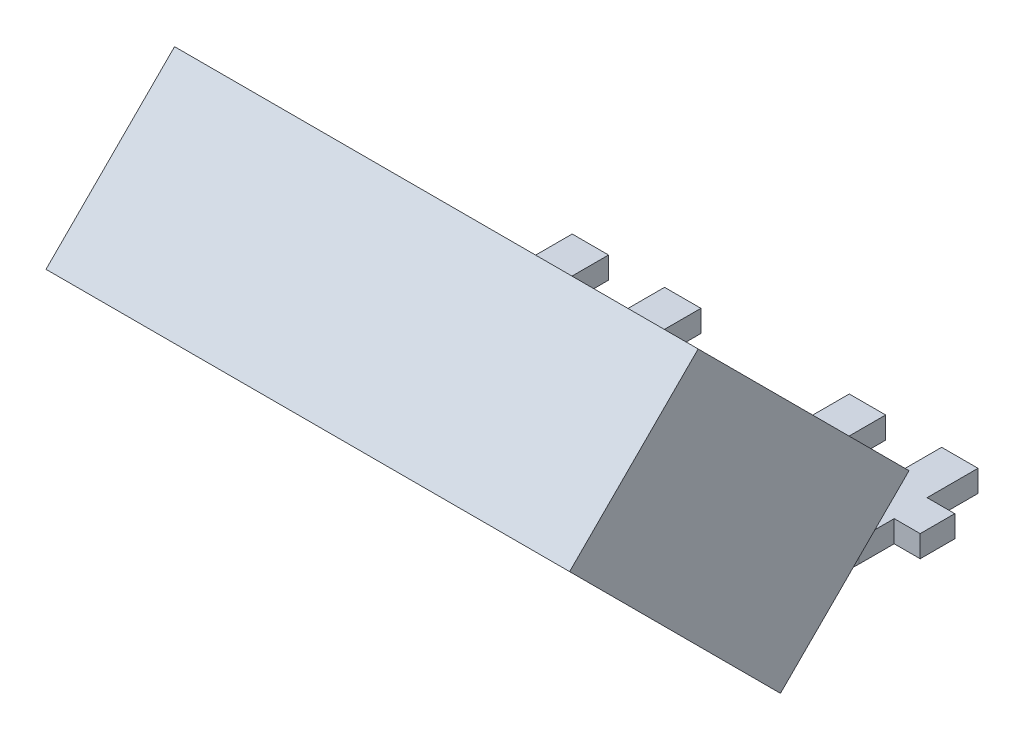
from build123d import *

# Parameters (mm, degrees)
ESQUISSE2_W          = 7.2
ESQUISSE2_H          = 2.5
BOITIER_DEPTH        = 4.1
FENETRECAPTEUR_START = -1.45
ESQUISSE4_R          = 0.8
FENETRECAPTEUR_DEPTH = 0.1
PATTES_DEPTH         = 0.15
PLIAGE_START         = -5
PLIAGE_1_OUTLINE_W   = 7.2
PLIAGE_1_OUTLINE_H   = 4.1
PLIAGE_1_DEPTH       = 4.301040764
PLIAGE_START_2       = -0.698959236
PLIAGE_1_2_OUTLINE_R = 0.8
PLIAGE_1_2_DEPTH     = 0.1
PLIAGE_START_3       = -0.598959236
PLIAGE_1_3_OUTLINE_W = 7.2
PLIAGE_1_3_OUTLINE_H = 4.1
PLIAGE_1_3_DEPTH     = 2.4
PLIAGE_1_4_OUTLINE_W = 7.2
PLIAGE_1_4_OUTLINE_H = 4.1
PLIAGE_1_4_OUTLINE_R = 0.8
PLIAGE_1_4_DEPTH     = 0.1
PLIAGE_START_4       = -3.6
PLIAGE_1_5_DEPTH     = 7.2
PLIAGE_START_5       = -2.813242849
PLIAGE_1_6_DEPTH     = 0.546485698
PLIAGE_START_6       = -1.543242849
PLIAGE_1_7_DEPTH     = 0.546485698
PLIAGE_START_7       = 0.996757151
PLIAGE_1_8_DEPTH     = 0.546485698
PLIAGE_START_8       = 2.266757151
PLIAGE_1_9_DEPTH     = 0.546485698
PLIAGE_START_9       = 0.601040763
PLIAGE_1_10_DEPTH    = 0.300000001


with BuildPart() as part:
    # Esquisse2 → Boitier (new body)
    with BuildSketch(Plane.XY):
        with Locations((0, -0.2)):
            Rectangle(ESQUISSE2_W, ESQUISSE2_H)
    extrude(amount=BOITIER_DEPTH)

    # Esquisse4 → FenetreCapteur (cut)
    with BuildSketch(Plane(origin=(0, 0, 0), x_dir=(1, 0, 0), z_dir=(0, 1, 0)).offset(FENETRECAPTEUR_START)):
        with Locations(Location((-1.27, -2.3, 0), (0, 0, 180))):
            Circle(ESQUISSE4_R)
        with Locations(Location((1.27, -2.3, 0), (0, 0, 180))):
            Circle(ESQUISSE4_R)
    extrude(amount=FENETRECAPTEUR_DEPTH, mode=Mode.SUBTRACT)

    # Esquisse5 → Pattes (add, symmetric)
    with BuildSketch(Plane(origin=(0, 0, 0), x_dir=(1, 0, 0), z_dir=(0, 1, 0))):
        Polygon((2.79, 2.2), (2.79, 2.9), (2.29, 2.9), (2.29, 2.2), (2.053248267, 2.2), (2.053248267, 1.724539267), (2.266757151, 1.724539267), (2.266757151, 0.7), (2.002499851, 0), (2.991852509, 0), (2.813242849, 0.7), (2.813242849, 1.724539267), (3.170462168, 1.724539267), (3.170462168, 2.2), align=None)
        Polygon((1.52, 2.2), (1.52, 2.9), (1.02, 2.9), (1.02, 2.2), (0.639537832, 2.2), (0.639537832, 1.724539267), (0.996757151, 1.724539267), (0.996757151, 0.7), (0.818147491, 0), (1.807500149, 0), (1.543242849, 0.7), (1.543242849, 1.724539267), (1.756751733, 1.724539267), (1.756751733, 2.2), align=None)
        Polygon((-1.02, 2.2), (-1.02, 2.9), (-1.52, 2.9), (-1.52, 2.2), (-1.756751733, 2.2), (-1.756751733, 1.724539267), (-1.543242849, 1.724539267), (-1.543242849, 0.7), (-1.807500149, 0), (-0.818147491, 0), (-0.996757151, 0.7), (-0.996757151, 1.724539267), (-0.639537832, 1.724539267), (-0.639537832, 2.2), align=None)
        Polygon((-2.29, 2.2), (-2.29, 2.9), (-2.79, 2.9), (-2.79, 2.2), (-3.170462168, 2.2), (-3.170462168, 1.724539267), (-2.813242849, 1.724539267), (-2.813242849, 0.7), (-2.991852509, 0), (-2.002499851, 0), (-2.266757151, 0.7), (-2.266757151, 1.724539267), (-2.053248267, 1.724539267), (-2.053248267, 2.2), align=None)
    extrude(amount=PATTES_DEPTH, both=True)

    # Pliage 1: read off the stored shape, not the designer's step
    # Pliage 1 outline → Pliage 1 (cut)
    with BuildSketch(Plane(origin=(0, 0, 0), x_dir=(1, 0, 0), z_dir=(0, 0.707106781186546, -0.707106781186549)).offset(PLIAGE_START)):
        with Locations((0, -2.236827202)):
            Rectangle(PLIAGE_1_OUTLINE_W, PLIAGE_1_OUTLINE_H)
    extrude(amount=PLIAGE_1_DEPTH, mode=Mode.SUBTRACT)

    # Pliage 1 2 outline → Pliage 1 2 (cut)
    with BuildSketch(Plane(origin=(0, 0, 0), x_dir=(1, 0, 0), z_dir=(0, 0.707106781186546, -0.707106781186549)).offset(PLIAGE_START_2)):
        with Locations((-1.27, -2.486827202)):
            Circle(PLIAGE_1_2_OUTLINE_R)
        with Locations((1.27, -2.486827202)):
            Circle(PLIAGE_1_2_OUTLINE_R)
    extrude(amount=PLIAGE_1_2_DEPTH, mode=Mode.SUBTRACT)

    # Pliage 1 3 outline → Pliage 1 3 (add)
    with BuildSketch(Plane(origin=(0, 0, 0), x_dir=(1, 0, 0), z_dir=(0, 0.707106781186546, -0.707106781186549)).offset(PLIAGE_START_3)):
        with Locations((0, -2.236827202)):
            Rectangle(PLIAGE_1_3_OUTLINE_W, PLIAGE_1_3_OUTLINE_H)
    extrude(amount=PLIAGE_1_3_DEPTH)

    # Pliage 1 4 outline → Pliage 1 4 (add)
    with BuildSketch(Plane(origin=(0, 0, 0), x_dir=(1, 0, 0), z_dir=(0, 0.707106781186546, -0.707106781186549)).offset(PLIAGE_START_2)):
        with Locations((0, -2.236827202)):
            Rectangle(PLIAGE_1_4_OUTLINE_W, PLIAGE_1_4_OUTLINE_H)
        with Locations((-1.27, -2.486827202)):
            Circle(PLIAGE_1_4_OUTLINE_R, mode=Mode.SUBTRACT)
        with Locations((1.27, -2.486827202)):
            Circle(PLIAGE_1_4_OUTLINE_R, mode=Mode.SUBTRACT)
    extrude(amount=PLIAGE_1_4_DEPTH)

    # Pliage 1 5 outline → Pliage 1 5 (cut)
    with BuildSketch(Plane.YZ.offset(PLIAGE_START_4)):
        with BuildLine():
            Line((0.021781873, -0.828218127), (0.15, -0.7))
            Line((0.15, -0.7), (0.15, 0))
            Line((0.15, 0), (0.264213563, 0))
            Line((0.264213563, 0), (-1.35, 1.614213563))
            Line((-1.35, 1.614213563), (-1.45, 1.714213563))
            Line((-1.45, 1.714213563), (-1.45, 0))
            Line((-1.45, 0), (-0.15, 0))
            Line((-0.15, 0), (-0.15, -1.242936254))
            ThreePointArc((-0.15, -1.242936254), (-0.105355346, -1.018492421), (0.021781873, -0.828218127))
        make_face()
    extrude(amount=PLIAGE_1_5_DEPTH, mode=Mode.SUBTRACT)

    # Pliage 1 6 outline → Pliage 1 6 (add)
    with BuildSketch(Plane.YZ.offset(PLIAGE_START_5)):
        with BuildLine():
            Line((0.769238816, -0.505025253), (0.557106781, -0.292893218))
            Line((0.557106781, -0.292893218), (0.15, -0.7))
            Line((0.15, -0.7), (0.15, -1.242936254))
            ThreePointArc((0.15, -1.242936254), (0.171808514, -1.133297451), (0.233913907, -1.040350162))
            Line((0.233913907, -1.040350162), (0.769238816, -0.505025253))
        make_face()
    extrude(amount=PLIAGE_1_6_DEPTH)

    # Pliage 1 7 outline → Pliage 1 7 (add)
    with BuildSketch(Plane.YZ.offset(PLIAGE_START_6)):
        with BuildLine():
            Line((0.769238816, -0.505025253), (0.557106781, -0.292893218))
            Line((0.557106781, -0.292893218), (0.15, -0.7))
            Line((0.15, -0.7), (0.15, -1.242936254))
            ThreePointArc((0.15, -1.242936254), (0.171808514, -1.133297451), (0.233913907, -1.040350162))
            Line((0.233913907, -1.040350162), (0.769238816, -0.505025253))
        make_face()
    extrude(amount=PLIAGE_1_7_DEPTH)

    # Pliage 1 8 outline → Pliage 1 8 (add)
    with BuildSketch(Plane.YZ.offset(PLIAGE_START_7)):
        with BuildLine():
            Line((0.769238816, -0.505025253), (0.557106781, -0.292893218))
            Line((0.557106781, -0.292893218), (0.15, -0.7))
            Line((0.15, -0.7), (0.15, -1.242936254))
            ThreePointArc((0.15, -1.242936254), (0.171808514, -1.133297451), (0.233913907, -1.040350162))
            Line((0.233913907, -1.040350162), (0.769238816, -0.505025253))
        make_face()
    extrude(amount=PLIAGE_1_8_DEPTH)

    # Pliage 1 9 outline → Pliage 1 9 (add)
    with BuildSketch(Plane.YZ.offset(PLIAGE_START_8)):
        with BuildLine():
            Line((0.769238816, -0.505025253), (0.557106781, -0.292893218))
            Line((0.557106781, -0.292893218), (0.15, -0.7))
            Line((0.15, -0.7), (0.15, -1.242936254))
            ThreePointArc((0.15, -1.242936254), (0.171808514, -1.133297451), (0.233913907, -1.040350162))
            Line((0.233913907, -1.040350162), (0.769238816, -0.505025253))
        make_face()
    extrude(amount=PLIAGE_1_9_DEPTH)

    # Pliage 1 10 outline → Pliage 1 10 (add)
    with BuildSketch(Plane(origin=(0, 0, 0), x_dir=(1, 0, 0), z_dir=(0, 0.707106781186546, -0.707106781186549)).offset(PLIAGE_START_9)):
        Polygon((2.813242849, 0.513172798), (2.813242849, -0.186827202), (2.991852509, -0.186827202), align=None)
        Polygon((-2.991852509, -0.186827202), (-2.813242849, -0.186827202), (-2.813242849, 0.513172798), align=None)
        Polygon((-2.266757151, -0.186827202), (-2.002499851, -0.186827202), (-2.266757151, 0.513172798), align=None)
        Polygon((-1.807500149, -0.186827202), (-1.543242849, -0.186827202), (-1.543242849, 0.513172798), align=None)
        Polygon((-0.996757151, -0.186827202), (-0.818147491, -0.186827202), (-0.996757151, 0.513172798), align=None)
        Polygon((0.818147491, -0.186827202), (0.996757151, -0.186827202), (0.996757151, 0.513172798), align=None)
        Polygon((1.543242849, -0.186827202), (1.807500149, -0.186827202), (1.543242849, 0.513172798), align=None)
        Polygon((2.266757151, 0.513172798), (2.002499851, -0.186827202), (2.266757151, -0.186827202), align=None)
    extrude(amount=PLIAGE_1_10_DEPTH)


solid = part.part
